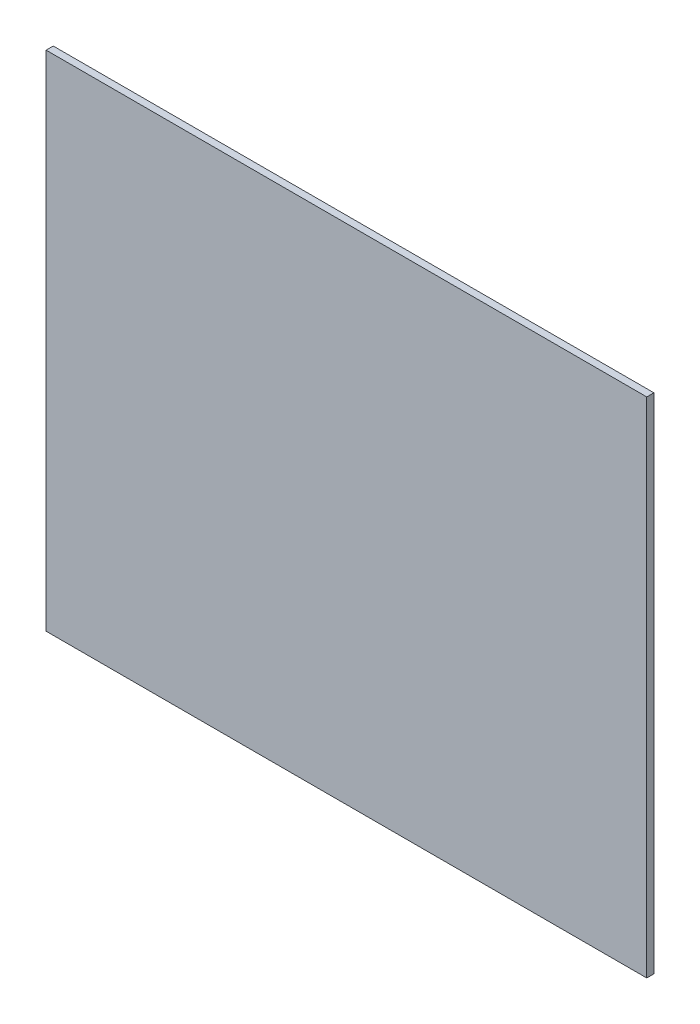
from build123d import *

# Parameters (mm, degrees)
SKETCH_1_W      = 420
SKETCH_1_H      = 351.89
EXTRUDE_1_DEPTH = 5


with BuildPart() as part:
    # 스케치1 → 보스-돌출1 (new body)
    with BuildSketch(Plane.XY):
        Rectangle(SKETCH_1_W, SKETCH_1_H)
    extrude(amount=EXTRUDE_1_DEPTH)


solid = part.part
